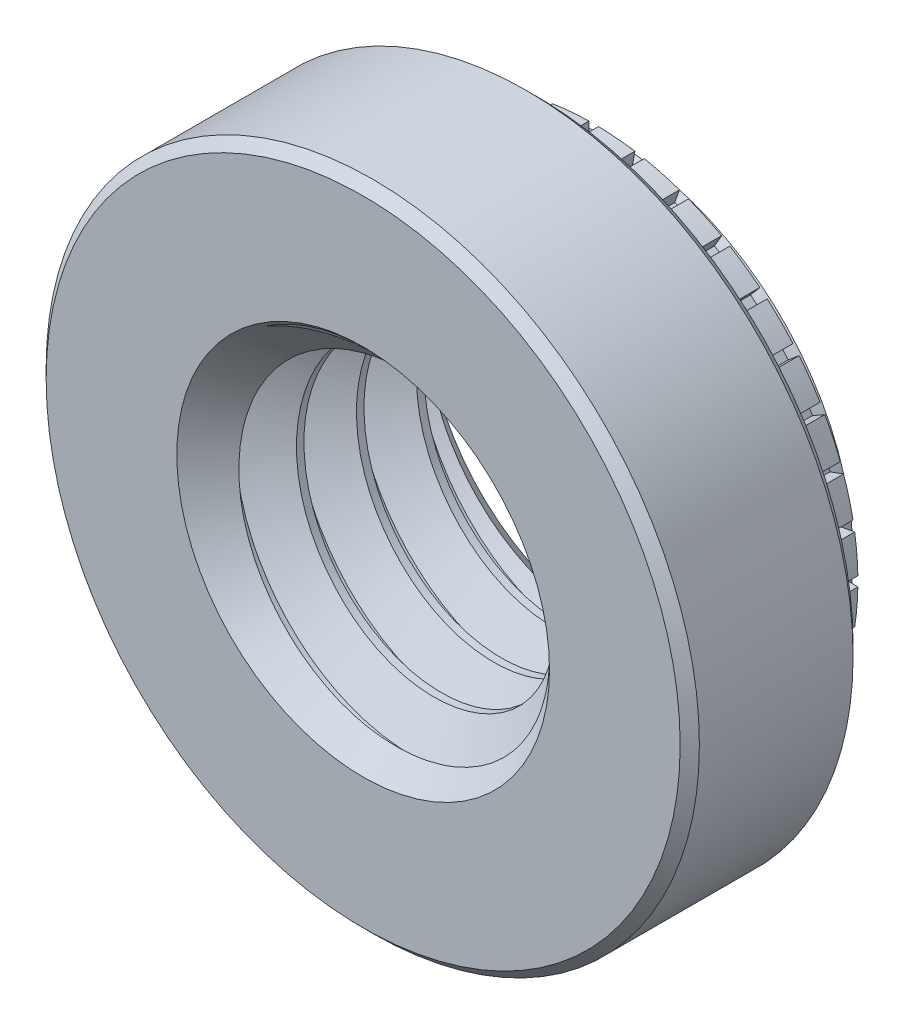
from build123d import *

# Parameters (mm, degrees)
SKETCH1_R               = 4.318
EXTRUDE1_DEPTH          = 2.286
SKETCH2_R               = 3.4925
EXTRUDE2_DEPTH          = 1.016
SKETCH3_W               = 0.127
SKETCH3_H               = 1.016
CUT_EXTRUDE_THIN1_DEPTH = 1.016
CIRPATTERN1_COUNT       = 36
SKETCH5_OUTSIDE_W       = 13.352
SKETCH5_OUTSIDE_H       = 13.352
SKETCH5_OUTSIDE_R       = 3.175
CUT_EXTRUDE1_DEPTH      = 0.254
CUT_EXTRUDE1_DRAFT      = 20
CHAMFER2_SIZE           = 0.127
SKETCH7_R               = 2.413
CUT_EXTRUDE3_DEPTH      = 7.942150387
SWEEP1_PITCH            = 0.79375
SKETCH10_R              = 4.318
CUT_EXTRUDE4_DEPTH      = 8.298211788
SKETCH11_R              = 3.175
CUT_EXTRUDE5_DEPTH      = 7.942150435


with BuildPart() as part:
    # Sketch1 → Extrude1 (new body)
    with BuildSketch(Plane.XY):
        Circle(SKETCH1_R)
    extrude(amount=-EXTRUDE1_DEPTH)

    # Sketch2 → Extrude2 (add)
    with BuildSketch(Plane(origin=(0, 0, -2.286), x_dir=(-1, 0, 0), z_dir=(0, 0, -1))):
        with Locations(Location((0, 0, 0), (0, 0, 180))):
            Circle(SKETCH2_R)
    extrude(amount=EXTRUDE2_DEPTH)

    # Sketch3 → Cut-Extrude-Thin1 (cut)
    with BuildSketch(Plane(origin=(0, 0, -3.302), x_dir=(-1, 0, 0), z_dir=(0, 0, -1))):
        with Locations((0, 3.81)):
            Rectangle(SKETCH3_W, SKETCH3_H)
    cut_extrude_thin1 = extrude(amount=-CUT_EXTRUDE_THIN1_DEPTH, mode=Mode.SUBTRACT)

    # CirPattern1: Cut-Extrude-Thin1 ×36 about axis
    cirpattern1_axis = Axis((0, 0, 0), (0, 0, 1))
    for i in range(1, CIRPATTERN1_COUNT):
        add(cut_extrude_thin1.rotate(cirpattern1_axis, i * 360 / CIRPATTERN1_COUNT), mode=Mode.SUBTRACT)


with BuildPart() as cut_extrude1_tool:
    # Sketch5 outside → Cut-Extrude1 (with draft: the straight prism first)
    with BuildSketch(Plane(origin=(0, 0, -3.302), x_dir=(-1, 0, 0), z_dir=(0, 0, -1))):
        Rectangle(SKETCH5_OUTSIDE_W, SKETCH5_OUTSIDE_H)
        Circle(SKETCH5_OUTSIDE_R, mode=Mode.SUBTRACT)
    extrude(amount=-CUT_EXTRUDE1_DEPTH)
    # Cut-Extrude1: the draft: its side faces are tilted about the plane it starts from
    cut_extrude1_sides = [cut_extrude1_tool.faces().sort_by_distance(p)[0] for p in [
        (0, -6.676, -3.175),
        (-6.676, 0, -3.175),
        (0, 6.676, -3.175),
        (6.676, 0, -3.175),
        (3.175, 0, -3.175),
    ]]
    draft(cut_extrude1_sides, Plane(origin=(0, 0, -3.302), x_dir=(-1, 0, 0), z_dir=(0, 0, -1)), CUT_EXTRUDE1_DRAFT)


with BuildPart() as part_1:
    add(part.part)

    # Cut-Extrude1: cut by cut_extrude1_tool
    add(cut_extrude1_tool.part, mode=Mode.SUBTRACT)

    # Chamfer2
    chamfer2_edges = [part_1.edges().sort_by_distance(p)[0] for p in [
        (-4.318, 0, 0),
        (-4.318, 0, -2.286),
    ]]
    chamfer(chamfer2_edges, length=CHAMFER2_SIZE)

    # Sketch7 → Cut-Extrude3 (cut, through all)
    with BuildSketch(Plane.XY):
        Circle(SKETCH7_R)
    extrude(amount=-CUT_EXTRUDE3_DEPTH, mode=Mode.SUBTRACT)

    # Sweep1: the profile of Sketch9 profile screwed along a right-hand helix of 8.16 turns, 6 arcs to a turn; built about Z, then put on its axis
    sweep1_z = Axis((0, 0, 0), (0, 0, 1))
    sweep1_corners = [(2.4133, 0, -0.694704455), (1.897444252, 0, -0.396875), (1.897444252, 0, -0.29765625), (2.4133, 0, 0.000173205)]
    with BuildLine(mode=Mode.PRIVATE) as sweep1_profile:
        Line(sweep1_corners[0], sweep1_corners[1])
        Line(sweep1_corners[1], sweep1_corners[2])
        Line(sweep1_corners[2], sweep1_corners[3])
        Line(sweep1_corners[3], sweep1_corners[0])
    sweep1_cap = Face(sweep1_profile.wire())
    sweep1_turn_angles = [0, 30, 60, 90, 120, 150, 180, 210, 240, 270, 300, 330, 360]
    sweep1_turn_weights = [1, 0.8660254037844387, 1, 0.8660254037844387, 1, 0.8660254037844387, 1, 0.8660254037844387, 1, 0.8660254037844387, 1, 0.8660254037844387, 1]
    sweep1_turn_rails = [Edge.make_bspline([Vector(p[0], p[1], 0).rotate(sweep1_z, sweep1_turn_angles[k]) / sweep1_turn_weights[k] + Vector(0, 0, p[2] + SWEEP1_PITCH * sweep1_turn_angles[k] / 360) for k in range(13)], [0, 0, 0, 1, 1, 2, 2, 3, 3, 4, 4, 5, 5, 6, 6, 6], 2, sweep1_turn_weights) for p in sweep1_corners]
    sweep1_turn_sides = [Face.make_surface_from_curves(sweep1_turn_rails[p[0]], sweep1_turn_rails[p[1]]) for p in [(0, 1), (1, 2), (2, 3), (3, 0)]]
    sweep1_turn = Solid(Shell([*sweep1_turn_sides, sweep1_cap, sweep1_cap.rotate(sweep1_z, 360).moved(Location((0, 0, SWEEP1_PITCH * 360 / 360)))]))
    sweep1_last_angles = [2880, 2908.8, 2937.6]
    sweep1_last_weights = [1, 0.8763066800438525, 1]
    sweep1_last_rails = [Edge.make_bspline([Vector(p[0], p[1], 0).rotate(sweep1_z, sweep1_last_angles[k]) / sweep1_last_weights[k] + Vector(0, 0, p[2] + SWEEP1_PITCH * sweep1_last_angles[k] / 360) for k in range(3)], [0, 0, 0, 1, 1, 1], 2, sweep1_last_weights) for p in sweep1_corners]
    sweep1_last_sides = [Face.make_surface_from_curves(sweep1_last_rails[p[0]], sweep1_last_rails[p[1]]) for p in [(0, 1), (1, 2), (2, 3), (3, 0)]]
    sweep1_last = Solid(Shell([*sweep1_last_sides, sweep1_cap.rotate(sweep1_z, 2880).moved(Location((0, 0, SWEEP1_PITCH * 2880 / 360))), sweep1_cap.rotate(sweep1_z, 2937.6).moved(Location((0, 0, SWEEP1_PITCH * 2937.6 / 360)))]))
    sweep1_each = [*[sweep1_turn.moved(Location((0, 0, SWEEP1_PITCH * i))) for i in range(8)], sweep1_last]
    add(Plane(origin=(0, 0, -3.302), x_dir=(0, 1, 0), z_dir=(0, 0, 1)) * Compound([sweep1_each[i] for i in range(0, 9, 2)]))
    add(Plane(origin=(0, 0, -3.302), x_dir=(0, 1, 0), z_dir=(0, 0, 1)) * Compound([sweep1_each[i] for i in range(1, 9, 2)]))

    # Sketch10 → Cut-Extrude4 (cut, through all)
    with BuildSketch(Plane.XY):
        Circle(SKETCH10_R)
    extrude(amount=CUT_EXTRUDE4_DEPTH, mode=Mode.SUBTRACT)

    # Sketch11 → Cut-Extrude5 (cut, through all)
    with BuildSketch(Plane(origin=(0, 0, -3.302), x_dir=(-1, 0, 0), z_dir=(0, 0, -1))):
        Circle(SKETCH11_R)
    extrude(amount=CUT_EXTRUDE5_DEPTH, mode=Mode.SUBTRACT)

    # Cut-Extrude6 cone 1 section (through the dimple's axis) → Cut-Extrude6 (revolve, cut)
    with BuildSketch(Plane(origin=(0, 0, 0), x_dir=(0, -1, 0), z_dir=(1, 0, 0))):
        Polygon((0, 0), (2.4638, 0), (0, 2.4638), align=None)
    revolve(axis=Axis((0, 0, 0), (0, 0, -1)), mode=Mode.SUBTRACT)

    # Cut-Extrude7 cone 1 section (through the dimple's axis) → Cut-Extrude7 (revolve, cut)
    with BuildSketch(Plane(origin=(0, 0, -3.302), x_dir=(0, 1, 0), z_dir=(1, 0, 0))):
        Polygon((0, 0), (2.4638, 0), (0, 2.4638), align=None)
    revolve(axis=Axis((0, 0, -3.302), (0, 0, 1)), mode=Mode.SUBTRACT)


solid = part_1.part
